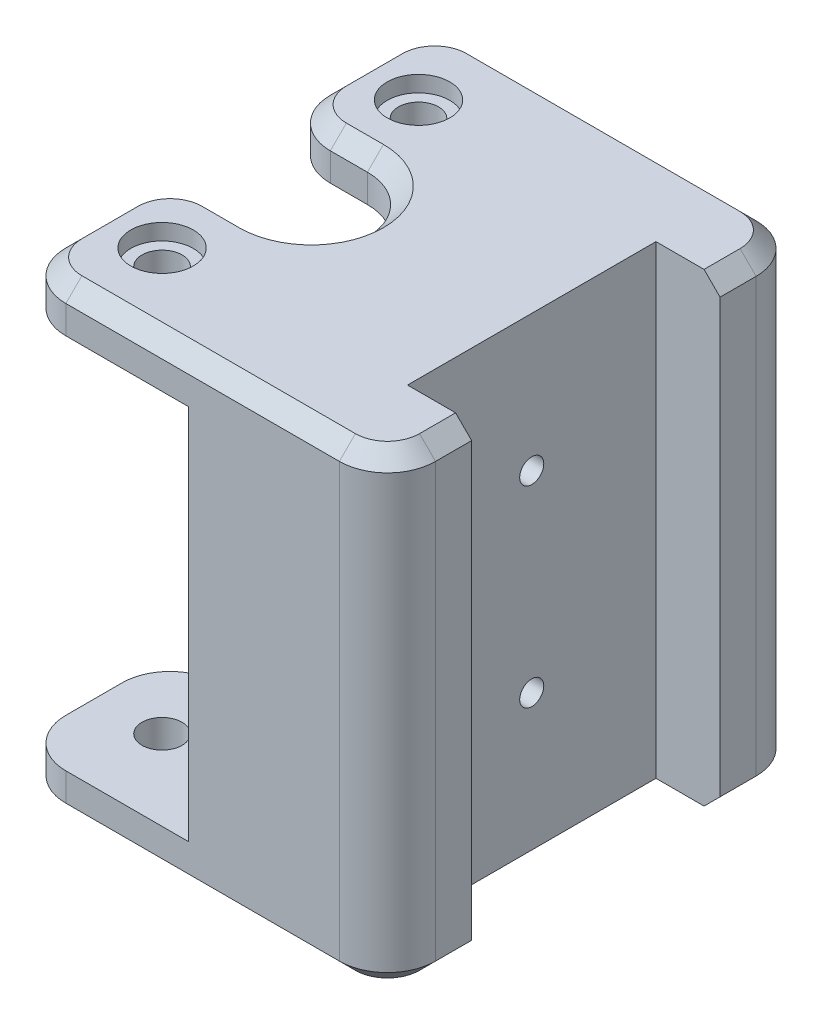
from build123d import *

# Parameters (mm, degrees)
SKETCH_2_W          = 23.064561435
SKETCH_2_H          = 26
SKETCH_2_R          = 1.25
EXTRUDE_1_DEPTH     = 14.5
SKETCH_3_R          = 33
CUT_EXTRUDE_1_DEPTH = 11.75
CUT_EXTRUDE_2_DEPTH = 54.268776032
SKETCH_5_W          = 15.5
SKETCH_5_H          = 29
CUT_EXTRUDE_3_DEPTH = 4
FILLET_1_R          = 3
SKETCH_6_R          = 0.75
CUT_EXTRUDE_4_DEPTH = 28.252660471
CHAMFER_1_SIZE      = 1
SKETCH_7_R          = 1.95
CUT_EXTRUDE_5_DEPTH = 1


with BuildPart() as part:
    # Эскиз2 → Бобышка-Вытянуть1 (new, symmetric)
    with BuildSketch(Plane(origin=(0, 0, 0), x_dir=(1, 0, 0), z_dir=(0, 1, 0))):
        with Locations((31.217719282, 0)):
            Rectangle(SKETCH_2_W, SKETCH_2_H)
        with Locations((23.685438565, 8)):
            Circle(SKETCH_2_R, mode=Mode.SUBTRACT)
        with Locations((23.685438565, -8)):
            Circle(SKETCH_2_R, mode=Mode.SUBTRACT)
    extrude(amount=EXTRUDE_1_DEPTH, both=True)

    # Эскиз3 → Вырез-Вытянуть1 (cut, symmetric)
    with BuildSketch(Plane(origin=(0, 0, 0), x_dir=(1, 0, 0), z_dir=(0, 1, 0))):
        Circle(SKETCH_3_R)
    extrude(amount=CUT_EXTRUDE_1_DEPTH, both=True, mode=Mode.SUBTRACT)

    # Эскиз4 → Вырез-Вытянуть2 (cut, through all)
    with BuildSketch(Plane(origin=(0, 14.5, 0), x_dir=(1, 0, 0), z_dir=(0, 1, 0))):
        with BuildLine():
            Line((19.685438565, -3.5), (25, -3.5))
            ThreePointArc((25, -3.5), (28.5, 0), (25, 3.5))
            Line((25, 3.5), (19.685438565, 3.5))
            Line((19.685438565, 3.5), (19.685438565, -3.5))
        make_face()
    extrude(amount=-CUT_EXTRUDE_2_DEPTH, mode=Mode.SUBTRACT)

    # Эскиз5 → Вырез-Вытянуть3 (cut)
    with BuildSketch(Plane(origin=(42.75, 0, 0), x_dir=(0, 0, -1), z_dir=(1, 0, 0))):
        Rectangle(SKETCH_5_W, SKETCH_5_H)
    extrude(amount=-CUT_EXTRUDE_3_DEPTH, mode=Mode.SUBTRACT)

    # Скругление1
    fillet_1_edges = [part.edges().sort_by_distance(p)[0] for p in [
        (42.75, 0, -13),
        (19.685438565, -13.125, -13),
        (19.685438565, -13.125, -3.5),
        (19.685438565, -13.125, 3.5),
        (19.685438565, -13.125, 13),
        (19.685438565, 13.125, -13),
        (19.685438565, 13.125, -3.5),
        (19.685438565, 13.125, 3.5),
        (19.685438565, 13.125, 13),
        (42.75, 0, 13),
    ]]
    fillet(fillet_1_edges, radius=FILLET_1_R)

    # Эскиз6 → Вырез-Вытянуть4 (cut, through all)
    with BuildSketch(Plane(origin=(38.75, 0, 0), x_dir=(0, 0, -1), z_dir=(1, 0, 0))):
        with Locations((0, 6)):
            Circle(SKETCH_6_R)
        with Locations((0, -6)):
            Circle(SKETCH_6_R)
    extrude(amount=-CUT_EXTRUDE_4_DEPTH, mode=Mode.SUBTRACT)

    # Фаска1
    chamfer_1_edges = [part.edges().sort_by_distance(p)[0] for p in [
        (42.75, -14.5, -8.875),
        (41.871320344, -14.5, -12.121320344),
        (31.217719282, -14.5, -13),
        (20.564118221, -14.5, -12.121320344),
        (19.685438565, -14.5, -8.25),
        (20.564118221, -14.5, -4.378679656),
        (23.842719282, -14.5, -3.5),
        (28.5, -14.5, 0),
        (23.842719282, -14.5, 3.5),
        (20.564118221, -14.5, 4.378679656),
        (19.685438565, -14.5, 8.25),
        (42.75, -14.5, 8.875),
        (20.564118221, -14.5, 12.121320344),
        (41.871320344, -14.5, 12.121320344),
        (31.217719282, -14.5, 13),
        (42.75, 14.5, -8.875),
        (41.871320344, 14.5, -12.121320344),
        (31.217719282, 14.5, -13),
        (20.564118221, 14.5, -12.121320344),
        (19.685438565, 14.5, -8.25),
        (20.564118221, 14.5, -4.378679656),
        (23.842719282, 14.5, -3.5),
        (28.5, 14.5, 0),
        (23.842719282, 14.5, 3.5),
        (20.564118221, 14.5, 4.378679656),
        (19.685438565, 14.5, 8.25),
        (42.75, 14.5, 8.875),
        (20.564118221, 14.5, 12.121320344),
        (41.871320344, 14.5, 12.121320344),
        (31.217719282, 14.5, 13),
    ]]
    chamfer(chamfer_1_edges, length=CHAMFER_1_SIZE)

    # Эскиз7 → Вырез-Вытянуть5 (cut)
    with BuildSketch(Plane(origin=(0, 14.5, 0), x_dir=(1, 0, 0), z_dir=(0, 1, 0))):
        with Locations((23.685438565, 8)):
            Circle(SKETCH_7_R)
        with Locations((23.685438565, -8)):
            Circle(SKETCH_7_R)
    cut_extrude_5 = extrude(amount=-CUT_EXTRUDE_5_DEPTH, mode=Mode.SUBTRACT)

    # Зеркальное отражение1: Вырез-Вытянуть5 across plane
    add(cut_extrude_5.mirror(Plane.ZX), mode=Mode.SUBTRACT)


solid = part.part
